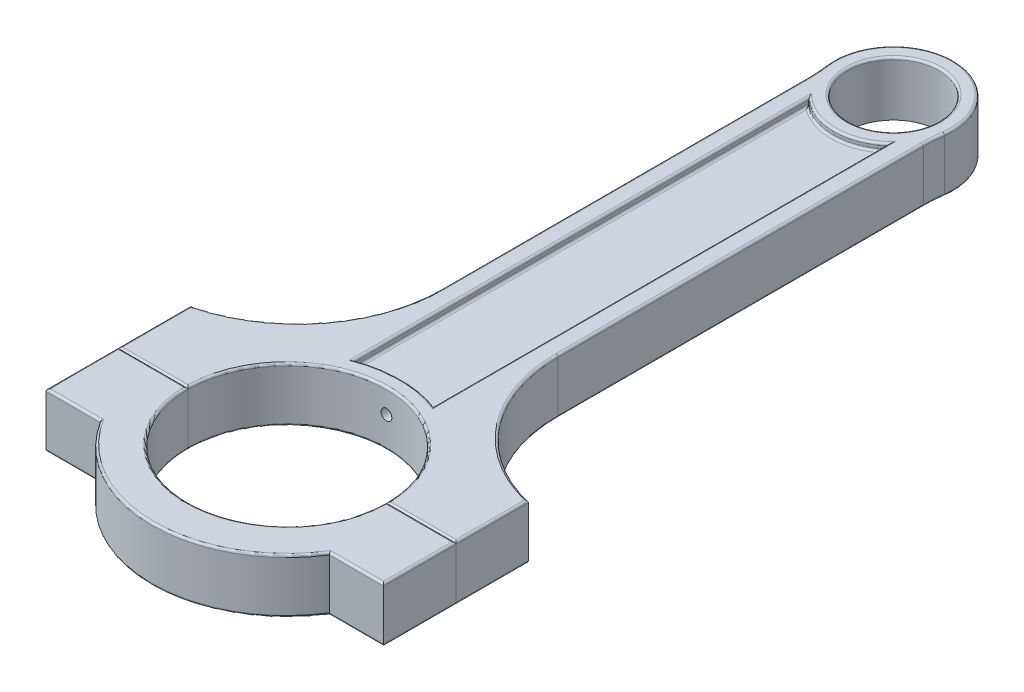
from build123d import *

# Parameters (mm, degrees)
MAIN_EXTRUDE_DEPTH      = 9.55675
MAIN_EXTRUDE_DEPTH_BACK = 9.55675
BASE_SKETCH_R           = 34.8742
BASE_SKETCH_R_2         = 16.002
CUT_EXTRUDE1_DEPTH      = 2.54
CUT_EXTRUDE2_START      = -16.5735
CUT_EXTRUDE2_DEPTH      = 2.54
CUT_EXTRUDE3_REACH      = 243.439
CUT_EXTRUDE3_END_RADIUS = 16.002
SKETCH2_R               = 1.905
FILLET1_R               = 0.762
FILLET2_R               = 0.762


with BuildPart() as part:
    # Base Sketch → Main Extrude (new, two sides: drawn at the far end of the back side and taken through both)
    with BuildSketch(Plane(origin=(0, 0, 0), x_dir=(1, 0, 0), z_dir=(0, 1, 0)).offset(-MAIN_EXTRUDE_DEPTH_BACK)):
        with BuildLine():
            Line((-40.226166927, -25.4), (-59.276166927, -25.4))
            Line((-59.276166927, -25.4), (-59.276166927, 25.4))
            ThreePointArc((-59.276166927, 25.4), (-31.230736281, 43.34393006), (-20.32, 74.800036621))
            Line((-20.32, 74.800036621), (-20.32, 202.97916839))
            ThreePointArc((-20.32, 202.97916839), (-20.440772515, 206.480011361), (-20.802515807, 209.964208442))
            ThreePointArc((-20.802515807, 209.964208442), (0, 233.854), (20.802515807, 209.964208442))
            ThreePointArc((20.802515807, 209.964208442), (20.440772515, 206.480011361), (20.32, 202.97916839))
            Line((20.32, 202.97916839), (20.32, 74.800036621))
            ThreePointArc((20.32, 74.800036621), (31.230736281, 43.34393006), (59.276166927, 25.4))
            Line((59.276166927, 25.4), (59.276166927, -25.4))
            Line((59.276166927, -25.4), (40.226166927, -25.4))
            ThreePointArc((40.226166927, -25.4), (0, -47.5742), (-40.226166927, -25.4))
        make_face()
        with Locations(Location((0, 0, 0), (0, 0, 270))):
            Circle(BASE_SKETCH_R, mode=Mode.SUBTRACT)
        with Locations(Location((0, 212.852, 0), (0, 0, 270))):
            Circle(BASE_SKETCH_R_2, mode=Mode.SUBTRACT)
    extrude(amount=MAIN_EXTRUDE_DEPTH + MAIN_EXTRUDE_DEPTH_BACK)

    # Sketch1 → Cut-Extrude1 (cut)
    with BuildSketch(Plane(origin=(0, 9.55675, 0), x_dir=(1, 0, 0), z_dir=(0, 1, 0))):
        with BuildLine():
            Line((-13.97, 37.432301527), (-13.97, 197.063085408))
            ThreePointArc((-13.97, 197.063085408), (0, 191.77), (13.97, 197.063085408))
            Line((13.97, 197.063085408), (13.97, 37.432301527))
            ThreePointArc((13.97, 37.432301527), (0, 39.9542), (-13.97, 37.432301527))
        make_face()
    extrude(amount=-CUT_EXTRUDE1_DEPTH, mode=Mode.SUBTRACT)

    # Sketch1<2> → Cut-Extrude2 (cut)
    with BuildSketch(Plane(origin=(0, 9.55675, 0), x_dir=(1, 0, 0), z_dir=(0, 1, 0)).offset(CUT_EXTRUDE2_START)):
        with BuildLine():
            Line((-13.97, 37.432301527), (-13.97, 197.063085408))
            ThreePointArc((-13.97, 197.063085408), (0, 191.77), (13.97, 197.063085408))
            Line((13.97, 197.063085408), (13.97, 37.432301527))
            ThreePointArc((13.97, 37.432301527), (0, 39.9542), (-13.97, 37.432301527))
        make_face()
    extrude(amount=-CUT_EXTRUDE2_DEPTH, mode=Mode.SUBTRACT)

    # Cut-Extrude3: up to this cylinder (the profile starts outside it)
    cut_extrude3_end = Plane(origin=(0, 1.185162, -212.852), z_dir=(0, 1, 0)) * Cylinder(CUT_EXTRUDE3_END_RADIUS, 519.882, mode=Mode.PRIVATE)
    # Sketch2 → Cut-Extrude3 (cut, up to the surface)
    with BuildSketch(Plane.XY, mode=Mode.PRIVATE) as cut_extrude3_sk1:
        with Locations((0, 1.185161877)):
            Circle(SKETCH2_R)
    cut_extrude3_tool1 = extrude(cut_extrude3_sk1.sketch, amount=-CUT_EXTRUDE3_REACH, mode=Mode.PRIVATE) - cut_extrude3_end
    add(cut_extrude3_tool1.solids().sort_by_distance((0, 1.185162, 0))[0], mode=Mode.SUBTRACT)


with BuildPart() as body_2:
    # Split3: the piece on the far side of the plane
    add(part.part)
    split(bisect_by=Plane.XY, keep=Keep.BOTTOM)

    # Fillet1
    fillet1_edges = [body_2.edges().sort_by_distance(p)[0] for p in [
        (0, -7.01675, -39.9542),
        (-13.97, -7.01675, -117.247693468),
        (0, -7.01675, -191.77),
        (13.97, -7.01675, -117.247693468),
        (0, 9.55675, -39.9542),
        (13.97, 9.55675, -117.247693468),
        (0, 9.55675, -191.77),
        (-13.97, 9.55675, -117.247693468),
        (0, 7.01675, -39.9542),
        (13.97, 7.01675, -117.247693468),
        (0, 7.01675, -191.77),
        (-13.97, 7.01675, -117.247693468),
        (-20.440772515, 9.55675, -206.480011361),
        (-20.32, 9.55675, -138.889602505),
        (-31.230736281, 9.55675, -43.34393006),
        (-59.276166927, 9.55675, -12.7),
        (59.276166927, 9.55675, -12.7),
        (31.230736281, 9.55675, -43.34393006),
        (20.32, 9.55675, -138.889602505),
        (20.440772515, 9.55675, -206.480011361),
        (0, 9.55675, -233.854),
        (0, 9.55675, -228.854),
        (0, 9.55675, -34.8742),
        (-20.440772515, -9.55675, -206.480011361),
        (-20.32, -9.55675, -138.889602505),
        (-31.230736281, -9.55675, -43.34393006),
        (-59.276166927, -9.55675, -12.7),
        (59.276166927, -9.55675, -12.7),
        (31.230736281, -9.55675, -43.34393006),
        (20.32, -9.55675, -138.889602505),
        (20.440772515, -9.55675, -206.480011361),
        (0, -9.55675, -233.854),
        (0, -9.55675, -34.8742),
        (47.075183464, 9.55675, 0),
        (-47.075183464, 9.55675, 0),
        (-47.075183464, -9.55675, 0),
        (47.075183464, -9.55675, 0),
    ]]
    fillet(fillet1_edges, radius=FILLET1_R - 0.0001)  # a hair under: the kernel refuses the full size


with BuildPart() as part_1:
    add(part.part)

    # Split3
    split(bisect_by=Plane.XY, keep=Keep.TOP)

    # Fillet2
    fillet2_edges = [part_1.edges().sort_by_distance(p)[0] for p in [
        (24.659783308, 9.55675, 24.659783308),
        (24.659783308, -9.55675, 24.659783308),
        (47.075183464, -9.55675, 0),
        (-47.075183464, -9.55675, 0),
        (-47.075183464, 9.55675, 0),
        (47.075183464, 9.55675, 0),
        (-59.276166927, -9.55675, 12.7),
        (-49.751166927, -9.55675, 25.4),
        (0, -9.55675, 47.5742),
        (49.751166927, -9.55675, 25.4),
        (59.276166927, -9.55675, 12.7),
        (-59.276166927, 9.55675, 12.7),
        (-49.751166927, 9.55675, 25.4),
        (0, 9.55675, 47.5742),
        (49.751166927, 9.55675, 25.4),
        (59.276166927, 9.55675, 12.7),
    ]]
    fillet(fillet2_edges, radius=FILLET2_R)


solid = Compound([body_2.part, part_1.part])
